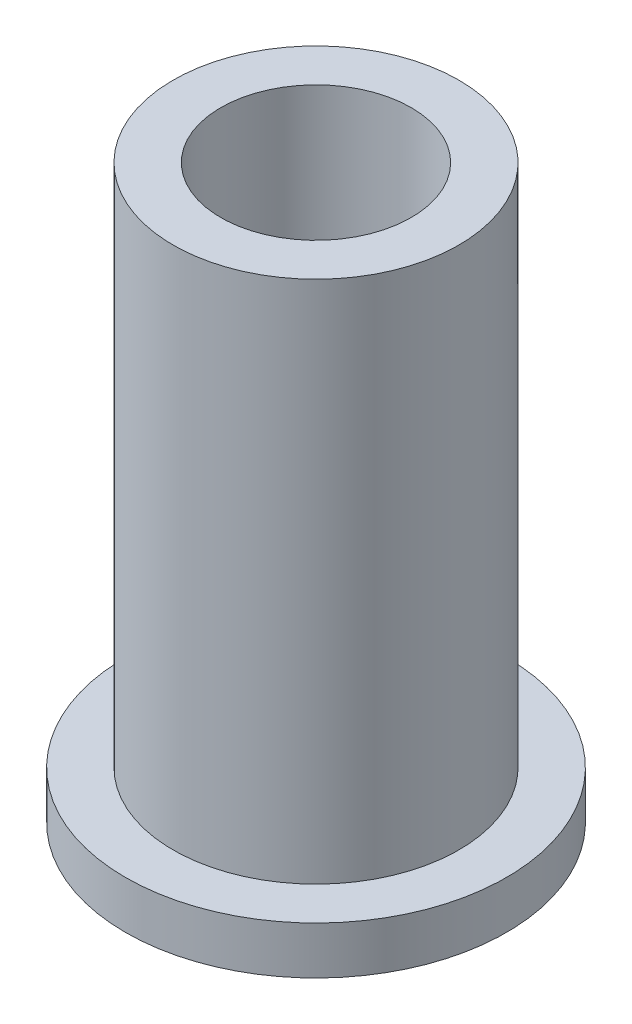
from build123d import *

# Parameters (mm, degrees)
SKETCH1_R           = 4.7625
SKETCH1_R_2         = 3.175
BOSS_EXTRUDE1_DEPTH = 19.05
SKETCH2_R           = 6.35
SKETCH2_R_2         = 4.7625
BOSS_EXTRUDE2_DEPTH = 1.5875


with BuildPart() as part:
    # Sketch1 → Boss-Extrude1 (new body)
    with BuildSketch(Plane(origin=(0, 0, 0), x_dir=(1, 0, 0), z_dir=(0, 1, 0))):
        Circle(SKETCH1_R)
        Circle(SKETCH1_R_2, mode=Mode.SUBTRACT)
    extrude(amount=BOSS_EXTRUDE1_DEPTH)

    # Sketch2 → Boss-Extrude2 (add)
    with BuildSketch(Plane.XZ):
        Circle(SKETCH2_R)
        Circle(SKETCH2_R_2, mode=Mode.SUBTRACT)
    extrude(amount=-BOSS_EXTRUDE2_DEPTH)


solid = part.part
